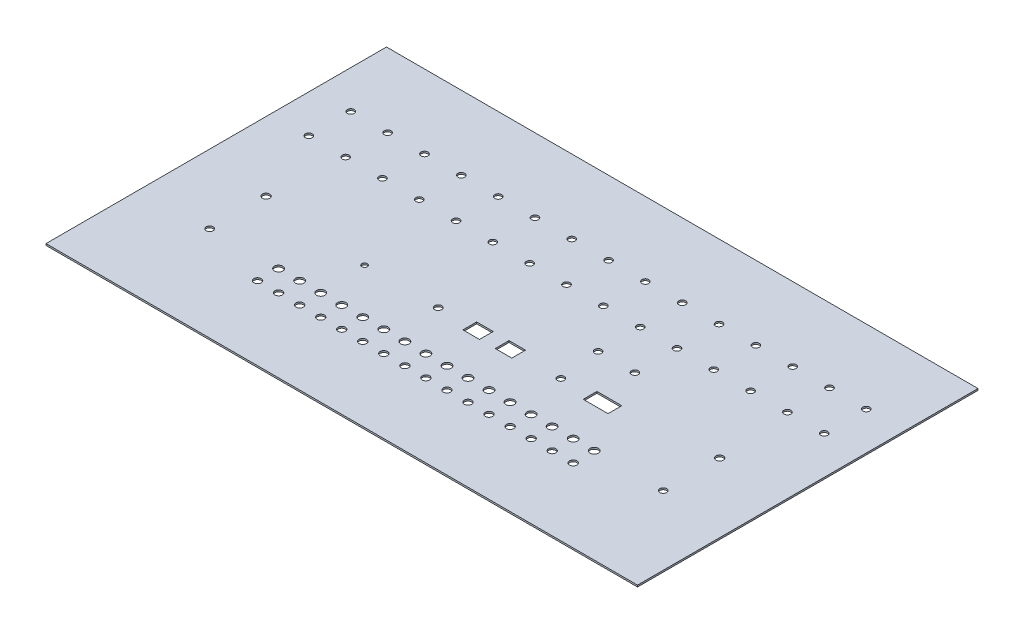
from build123d import *

# Parameters (mm, degrees)
SKETCH1_W            = 562.3
SKETCH1_H            = 323.65
BOSS_EXTRUDE1_DEPTH  = 1.5875
CUT_EXTRUDE1_REACH   = 326.4
SKETCH2_R            = 3.25
LPATTERN1_COUNT      = 15
LPATTERN1_PITCH      = 35
LPATTERN1_COUNT_DIR2 = 2
LPATTERN1_PITCH_DIR2 = 40
CUT_EXTRUDE2_REACH   = 326.4
SKETCH6_R            = 3.5
LPATTERN2_COUNT      = 16
LPATTERN2_PITCH      = 20
CUT_EXTRUDE3_REACH   = 326.4
SKETCH7_R            = 4
LPATTERN3_COUNT      = 16
LPATTERN3_PITCH      = 20
CUT_EXTRUDE4_REACH   = 326.4
SKETCH8_R            = 3.3
CUT_EXTRUDE5_REACH   = 326.4
SKETCH10_R           = 3.25
CUT_EXTRUDE6_REACH   = 326.4
SKETCH11_R           = 3.3
CUT_EXTRUDE7_REACH   = 326.4
SKETCH15_W           = 23.61
SKETCH15_H           = 13.08
CUT_EXTRUDE8_REACH   = 326.4
SKETCH16_R           = 3.3
CUT_EXTRUDE9_REACH   = 326.4
SKETCH18_W           = 15.74
SKETCH18_H           = 13.08
CUT_EXTRUDE10_REACH  = 326.4
SKETCH19_W           = 15.74
SKETCH19_H           = 13.08
CUT_EXTRUDE11_REACH  = 326.4
SKETCH22_R           = 2.605
CUT_EXTRUDE12_REACH  = 326.4
SKETCH24_R           = 3.5
CUT_EXTRUDE13_REACH  = 326.4
SKETCH26_R           = 3.5
CUT_EXTRUDE14_REACH  = 326.4
SKETCH28_R           = 3.25
CUT_EXTRUDE15_REACH  = 326.4
SKETCH29_R           = 3.25


with BuildPart() as part:
    # Sketch1 → Boss-Extrude1 (new body)
    with BuildSketch(Plane(origin=(0, 0, 0), x_dir=(1, 0, 0), z_dir=(0, 1, 0))):
        Rectangle(SKETCH1_W, SKETCH1_H)
    extrude(amount=BOSS_EXTRUDE1_DEPTH)

    # Sketch2 → Cut-Extrude1 (cut, up to next)
    with BuildSketch(Plane(origin=(0, 1.5875, 0), x_dir=(1, 0, 0), z_dir=(0, 1, 0)), mode=Mode.PRIVATE) as cut_extrude1_sk1:
        with Locations((-245, 91.825)):
            Circle(SKETCH2_R)
    cut_extrude1_tool1 = extrude(cut_extrude1_sk1.sketch, amount=-CUT_EXTRUDE1_REACH, mode=Mode.PRIVATE) & part.part
    cut_extrude1 = cut_extrude1_tool1.solids().sort_by_distance((-245, 1.5875, -91.825))[0]
    add(cut_extrude1, mode=Mode.SUBTRACT)

    # LPattern1: Cut-Extrude1 15 × 2
    with Locations(*[(i * LPATTERN1_PITCH, 0, j * LPATTERN1_PITCH_DIR2) for i in range(LPATTERN1_COUNT) for j in range(LPATTERN1_COUNT_DIR2) if (i, j) != (0, 0)]):
        add(cut_extrude1, mode=Mode.SUBTRACT)

    # Sketch6 → Cut-Extrude2 (cut, up to next)
    with BuildSketch(Plane(origin=(0, 1.5875, 0), x_dir=(1, 0, 0), z_dir=(0, 1, 0)), mode=Mode.PRIVATE) as cut_extrude2_sk1:
        with Locations((-150, -91.825)):
            Circle(SKETCH6_R)
    cut_extrude2_tool1 = extrude(cut_extrude2_sk1.sketch, amount=-CUT_EXTRUDE2_REACH, mode=Mode.PRIVATE) & part.part
    cut_extrude2 = cut_extrude2_tool1.solids().sort_by_distance((-150, 1.5875, 91.825))[0]
    add(cut_extrude2, mode=Mode.SUBTRACT)

    # LPattern2: Cut-Extrude2 ×16
    with Locations(*[(i * LPATTERN2_PITCH, 0, 0) for i in range(1, LPATTERN2_COUNT)]):
        add(cut_extrude2, mode=Mode.SUBTRACT)

    # Sketch7 → Cut-Extrude3 (cut, up to next)
    with BuildSketch(Plane(origin=(0, 1.5875, 0), x_dir=(1, 0, 0), z_dir=(0, 1, 0)), mode=Mode.PRIVATE) as cut_extrude3_sk1:
        with Locations((-150, -71.825)):
            Circle(SKETCH7_R)
    cut_extrude3_tool1 = extrude(cut_extrude3_sk1.sketch, amount=-CUT_EXTRUDE3_REACH, mode=Mode.PRIVATE) & part.part
    cut_extrude3 = cut_extrude3_tool1.solids().sort_by_distance((-150, 1.5875, 71.825))[0]
    add(cut_extrude3, mode=Mode.SUBTRACT)

    # LPattern3: Cut-Extrude3 ×16
    with Locations(*[(i * LPATTERN3_PITCH, 0, 0) for i in range(1, LPATTERN3_COUNT)]):
        add(cut_extrude3, mode=Mode.SUBTRACT)

    # Sketch8 → Cut-Extrude4 (cut, up to next)
    with BuildSketch(Plane(origin=(0, 1.5875, 0), x_dir=(1, 0, 0), z_dir=(0, 1, 0)), mode=Mode.PRIVATE) as cut_extrude4_sk1:
        with Locations((-215.575, -71.825)):
            Circle(SKETCH8_R)
    cut_extrude4_tool1 = extrude(cut_extrude4_sk1.sketch, amount=-CUT_EXTRUDE4_REACH, mode=Mode.PRIVATE) & part.part
    add(cut_extrude4_tool1.solids().sort_by_distance((-215.575, 1.5875, 71.825))[0], mode=Mode.SUBTRACT)

    # Sketch10 → Cut-Extrude5 (cut, up to next)
    with BuildSketch(Plane(origin=(0, 1.5875, 0), x_dir=(1, 0, 0), z_dir=(0, 1, 0)), mode=Mode.PRIVATE) as cut_extrude5_sk1:
        with Locations((215.575, -71.825)):
            Circle(SKETCH10_R)
    cut_extrude5_tool1 = extrude(cut_extrude5_sk1.sketch, amount=-CUT_EXTRUDE5_REACH, mode=Mode.PRIVATE) & part.part
    add(cut_extrude5_tool1.solids().sort_by_distance((215.575, 1.5875, 71.825))[0], mode=Mode.SUBTRACT)

    # Sketch11 → Cut-Extrude6 (cut, up to next)
    with BuildSketch(Plane(origin=(0, 1.5875, 0), x_dir=(1, 0, 0), z_dir=(0, 1, 0)), mode=Mode.PRIVATE) as cut_extrude6_sk1:
        with Locations((74.594310772, -28.175)):
            Circle(SKETCH11_R)
    cut_extrude6_tool1 = extrude(cut_extrude6_sk1.sketch, amount=-CUT_EXTRUDE6_REACH, mode=Mode.PRIVATE) & part.part
    add(cut_extrude6_tool1.solids().sort_by_distance((74.594311, 1.5875, 28.175))[0], mode=Mode.SUBTRACT)

    # Sketch15 → Cut-Extrude7 (cut, up to next)
    with BuildSketch(Plane(origin=(0, 1.5875, 0), x_dir=(1, 0, 0), z_dir=(0, 1, 0)), mode=Mode.PRIVATE) as cut_extrude7_sk1:
        with Locations((114.202396417, -28.175)):
            Rectangle(SKETCH15_W, SKETCH15_H)
    cut_extrude7_tool1 = extrude(cut_extrude7_sk1.sketch, amount=-CUT_EXTRUDE7_REACH, mode=Mode.PRIVATE) & part.part
    add(cut_extrude7_tool1.solids().sort_by_distance((114.202396, 1.5875, 28.175))[0], mode=Mode.SUBTRACT)

    # Sketch16 → Cut-Extrude8 (cut, up to next)
    with BuildSketch(Plane(origin=(0, 1.5875, 0), x_dir=(1, 0, 0), z_dir=(0, 1, 0)), mode=Mode.PRIVATE) as cut_extrude8_sk1:
        with Locations((-41.952521652, -28.175)):
            Circle(SKETCH16_R)
    cut_extrude8_tool1 = extrude(cut_extrude8_sk1.sketch, amount=-CUT_EXTRUDE8_REACH, mode=Mode.PRIVATE) & part.part
    add(cut_extrude8_tool1.solids().sort_by_distance((-41.952522, 1.5875, 28.175))[0], mode=Mode.SUBTRACT)

    # Sketch18 → Cut-Extrude9 (cut, up to next)
    with BuildSketch(Plane(origin=(0, 1.5875, 0), x_dir=(1, 0, 0), z_dir=(0, 1, 0)), mode=Mode.PRIVATE) as cut_extrude9_sk1:
        with Locations((-4.082521652, -28.175)):
            Rectangle(SKETCH18_W, SKETCH18_H)
    cut_extrude9_tool1 = extrude(cut_extrude9_sk1.sketch, amount=-CUT_EXTRUDE9_REACH, mode=Mode.PRIVATE) & part.part
    add(cut_extrude9_tool1.solids().sort_by_distance((-4.082522, 1.5875, 28.175))[0], mode=Mode.SUBTRACT)

    # Sketch19 → Cut-Extrude10 (cut, up to next)
    with BuildSketch(Plane(origin=(0, 1.5875, 0), x_dir=(1, 0, 0), z_dir=(0, 1, 0)), mode=Mode.PRIVATE) as cut_extrude10_sk1:
        with Locations((26.657478348, -28.175)):
            Rectangle(SKETCH19_W, SKETCH19_H)
    cut_extrude10_tool1 = extrude(cut_extrude10_sk1.sketch, amount=-CUT_EXTRUDE10_REACH, mode=Mode.PRIVATE) & part.part
    add(cut_extrude10_tool1.solids().sort_by_distance((26.657478, 1.5875, 28.175))[0], mode=Mode.SUBTRACT)

    # Sketch22 → Cut-Extrude11 (cut, up to next)
    with BuildSketch(Plane(origin=(0, 1.5875, 0), x_dir=(1, 0, 0), z_dir=(0, 1, 0)), mode=Mode.PRIVATE) as cut_extrude11_sk1:
        with Locations((-111.952521652, -28.175)):
            Circle(SKETCH22_R)
    cut_extrude11_tool1 = extrude(cut_extrude11_sk1.sketch, amount=-CUT_EXTRUDE11_REACH, mode=Mode.PRIVATE) & part.part
    add(cut_extrude11_tool1.solids().sort_by_distance((-111.952522, 1.5875, 28.175))[0], mode=Mode.SUBTRACT)

    # Sketch24 → Cut-Extrude12 (cut, up to next)
    with BuildSketch(Plane(origin=(0, 1.5875, 0), x_dir=(1, 0, 0), z_dir=(0, 1, 0)), mode=Mode.PRIVATE) as cut_extrude12_sk1:
        with Locations((-215.57, -18.175)):
            Circle(SKETCH24_R)
    cut_extrude12_tool1 = extrude(cut_extrude12_sk1.sketch, amount=-CUT_EXTRUDE12_REACH, mode=Mode.PRIVATE) & part.part
    add(cut_extrude12_tool1.solids().sort_by_distance((-215.57, 1.5875, 18.175))[0], mode=Mode.SUBTRACT)

    # Sketch26 → Cut-Extrude13 (cut, up to next)
    with BuildSketch(Plane(origin=(0, 1.5875, 0), x_dir=(1, 0, 0), z_dir=(0, 1, 0)), mode=Mode.PRIVATE) as cut_extrude13_sk1:
        with Locations((215.57, -18.175)):
            Circle(SKETCH26_R)
    cut_extrude13_tool1 = extrude(cut_extrude13_sk1.sketch, amount=-CUT_EXTRUDE13_REACH, mode=Mode.PRIVATE) & part.part
    add(cut_extrude13_tool1.solids().sort_by_distance((215.57, 1.5875, 18.175))[0], mode=Mode.SUBTRACT)

    # Sketch28 → Cut-Extrude14 (cut, up to next)
    with BuildSketch(Plane(origin=(0, 1.5875, 0), x_dir=(1, 0, 0), z_dir=(0, 1, 0)), mode=Mode.PRIVATE) as cut_extrude14_sk1:
        with Locations((70, 11.825)):
            Circle(SKETCH28_R)
    cut_extrude14_tool1 = extrude(cut_extrude14_sk1.sketch, amount=-CUT_EXTRUDE14_REACH, mode=Mode.PRIVATE) & part.part
    add(cut_extrude14_tool1.solids().sort_by_distance((70, 1.5875, -11.825))[0], mode=Mode.SUBTRACT)

    # Sketch29 → Cut-Extrude15 (cut, up to next)
    with BuildSketch(Plane(origin=(0, 1.5875, 0), x_dir=(1, 0, 0), z_dir=(0, 1, 0)), mode=Mode.PRIVATE) as cut_extrude15_sk1:
        with Locations((105, 11.825)):
            Circle(SKETCH29_R)
    cut_extrude15_tool1 = extrude(cut_extrude15_sk1.sketch, amount=-CUT_EXTRUDE15_REACH, mode=Mode.PRIVATE) & part.part
    add(cut_extrude15_tool1.solids().sort_by_distance((105, 1.5875, -11.825))[0], mode=Mode.SUBTRACT)


solid = part.part
